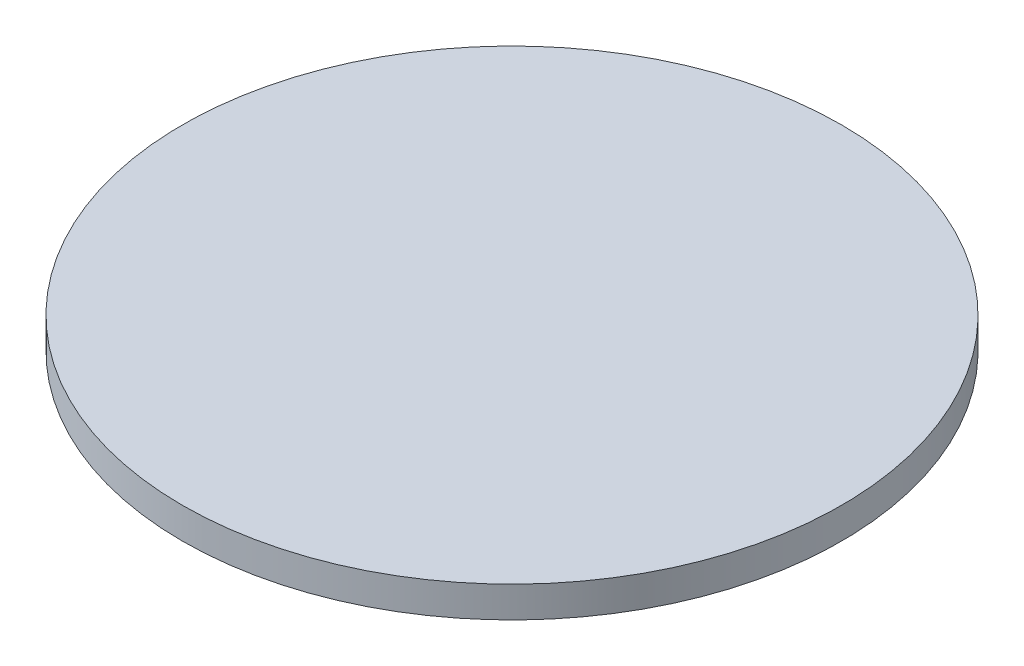
from build123d import *

# Parameters (mm, degrees)
SKETCH1_R           = 42.5
BOSS_EXTRUDE1_DEPTH = 4


with BuildPart() as part:
    # Sketch1 → Boss-Extrude1 (new body)
    with BuildSketch(Plane(origin=(0, 0, 0), x_dir=(1, 0, 0), z_dir=(0, 1, 0))):
        Circle(SKETCH1_R)
    extrude(amount=BOSS_EXTRUDE1_DEPTH)


solid = part.part
